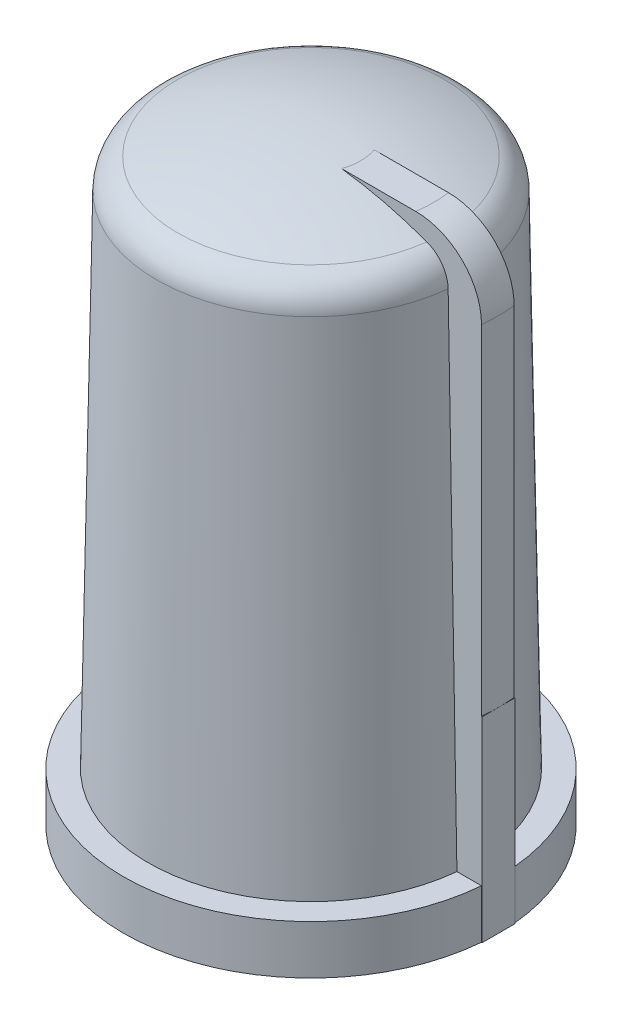
from build123d import *
from build123d.topology import SkipClean

# Parameters (mm, degrees)
SKETCH1_R                = 5.75
SKETCH1_R_2              = 3
BOSS_EXTRUDE1_DEPTH      = 1.5
SKETCH2_R                = 5
BOSS_EXTRUDE2_DEPTH      = 16
BOSS_EXTRUDE2_TAPER      = 1
FILLET1_R                = 1
BOSS_EXTRUDE3_REACH      = 22.208
BOSS_EXTRUDE3_END_RADIUS = 5.75
SKETCH4_W                = 1
SKETCH4_H                = 16.9
FILLET2_R                = 2
CUT_EXTRUDE1_DEPTH       = 10
BOSS_EXTRUDE4_START      = 5.75
SKETCH6_W                = 1
SKETCH6_H                = 6
BOSS_EXTRUDE4_DEPTH      = 0.5


# Read off the part's stored shape, not the designer's step: Dome1
with BuildPart() as part:
    # Sketch1 → Boss-Extrude1 (new body)
    with BuildSketch(Plane(origin=(0, 0, 0), x_dir=(1, 0, 0), z_dir=(0, 1, 0))):
        with Locations(Location((0, 0, 0), (0, 0, 270))):
            Circle(SKETCH1_R)
        with Locations(Location((0, 0, 0), (0, 0, 270))):
            Circle(SKETCH1_R_2, mode=Mode.SUBTRACT)
    extrude(amount=BOSS_EXTRUDE1_DEPTH)

    # Sketch2 → Boss-Extrude2 (add)
    with BuildSketch(Plane(origin=(0, 1.5, 0), x_dir=(1, 0, 0), z_dir=(0, 1, 0))):
        Circle(SKETCH2_R)
    extrude(amount=BOSS_EXTRUDE2_DEPTH, taper=BOSS_EXTRUDE2_TAPER)

    # Dome1 outline → Dome1 (revolve)
    with BuildSketch(Plane.XY):
        with BuildLine():
            Line((0, 17.5), (4.720718972, 17.499999995))
            ThreePointArc((4.720718972, 17.499999995), (2.412736394, 18.247256658), (0, 18.5))
            Line((0, 18.5), (0, 17.5))
        make_face()
    revolve(axis=Axis((0, 0, 0), (0, 1, 0)))

    # Fillet1
    fillet1_edges = [part.edges().sort_by_distance(p)[0] for p in [
        (-4.720718961, 17.5, 0),
    ]]
    fillet(fillet1_edges, radius=FILLET1_R)

    # Boss-Extrude3: up to this cylinder (the profile starts inside it)
    with SkipClean():  # the faces are left unmerged after this step: merging them gives an invalid solid
        boss_extrude3_end = Plane(origin=(0, 9.95, 0), z_dir=(0, -1, 0)) * Cylinder(BOSS_EXTRUDE3_END_RADIUS, 56.916, mode=Mode.PRIVATE)
        # Sketch4 → Boss-Extrude3 (add, up to the surface)
        with BuildSketch(Plane(origin=(0, 0, 0), x_dir=(0, 0, -1), z_dir=(1, 0, 0)), mode=Mode.PRIVATE) as boss_extrude3_sk1:
            with Locations((0, 9.95)):
                Rectangle(SKETCH4_W, SKETCH4_H)
        boss_extrude3_tool1 = extrude(boss_extrude3_sk1.sketch, amount=BOSS_EXTRUDE3_REACH, mode=Mode.PRIVATE) & boss_extrude3_end
        add(boss_extrude3_tool1.solids().sort_by_distance((0, 9.95, 0))[0])

    # Fillet2
    fillet2_edges = [part.edges().sort_by_distance(p)[0] for p in [
        (5.75, 18.4, 0),
    ]]
    fillet(fillet2_edges, radius=FILLET2_R)

    # Sketch5 → Cut-Extrude1 (cut)
    with BuildSketch(Plane(origin=(0, 0, 0), x_dir=(1, 0, 0), z_dir=(0, 1, 0))):
        with BuildLine():
            Line((-2.236067977, 2), (2.236067977, 2))
            ThreePointArc((2.236067977, 2), (0, -3), (-2.236067977, 2))
        make_face()
    extrude(amount=CUT_EXTRUDE1_DEPTH, mode=Mode.SUBTRACT)

    # Sketch6 → Boss-Extrude4 (add)
    with BuildSketch(Plane(origin=(0, 0, 0), x_dir=(0, 0, -1), z_dir=(1, 0, 0)).offset(BOSS_EXTRUDE4_START)):
        with Locations((0, 3)):
            Rectangle(SKETCH6_W, SKETCH6_H)
    extrude(amount=-BOSS_EXTRUDE4_DEPTH)


solid = part.part
